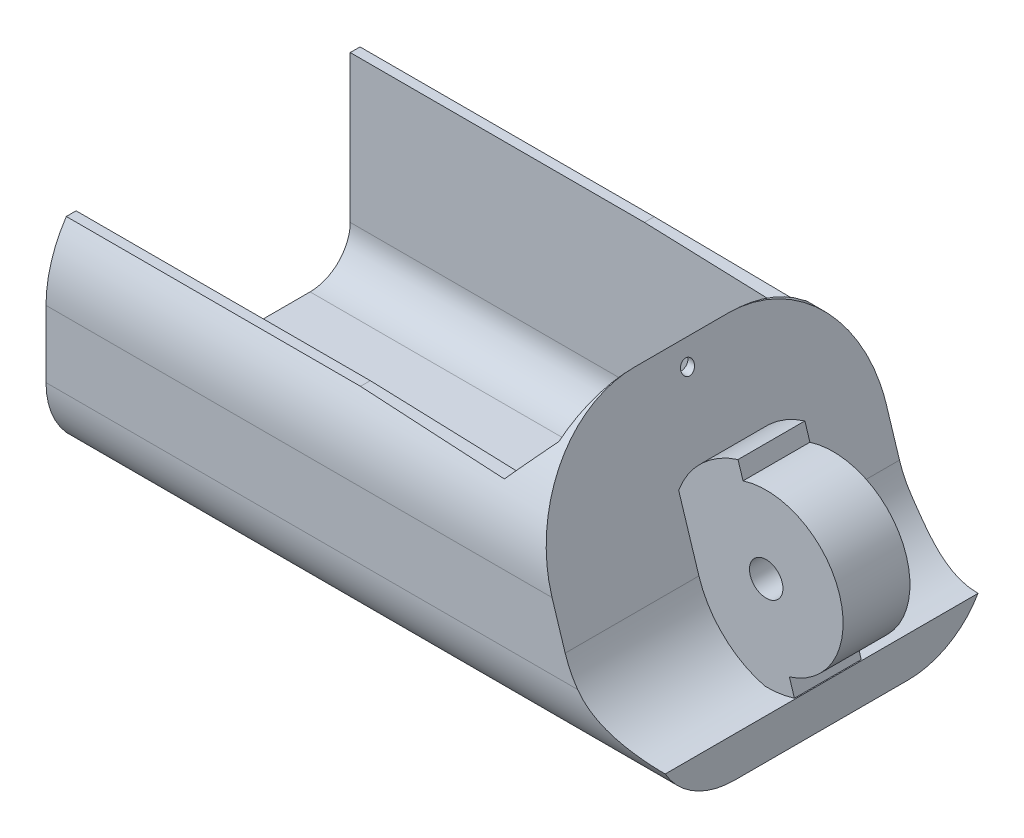
from build123d import *

# Parameters (mm, degrees)
CROQUIS1_W              = 105
CROQUIS1_H              = 40
SALIENTE_EXTRUIR1_DEPTH = 25
CORTAR_EXTRUIR1_DEPTH   = 50
CORTAR_EXTRUIR2_DEPTH   = 50
CROQUIS6_R              = 2.5
SALIENTE_EXTRUIR3_DEPTH = 5
CORTAR_EXTRUIR3_DEPTH   = 76.208044782
REDONDEO2_R             = 12
CORTAR_EXTRUIR4_DEPTH   = 110
CORTAR_EXTRUIR5_DEPTH   = 66
CROQUIS12_W             = 20
CROQUIS12_H             = 8
CROQUIS12_W_2           = 15.331196302
CROQUIS12_H_2           = 3
SALIENTE_EXTRUIR4_DEPTH = 2.5
CROQUIS13_R             = 1
CORTAR_EXTRUIR6_DEPTH   = 10
REDONDEO3_R             = 2
REDONDEO4_R             = 2
REDONDEO5_R             = 1


with BuildPart() as part:
    # Croquis1 → Saliente-Extruir1 (new, symmetric)
    with BuildSketch(Plane.XY):
        Rectangle(CROQUIS1_W, CROQUIS1_H)
    extrude(amount=SALIENTE_EXTRUIR1_DEPTH, both=True)

    # Croquis2 → Cortar-Extruir1 (cut)
    with BuildSketch(Plane.XY.offset(25)):
        Polygon((-52.5, 20), (-52.5, 12), (-46.5, 12), (-26.5, 12), (-8.5, 12), (13.5, 11.241881844), (17.5, 16), (17.5, 20), align=None)
    extrude(amount=-CORTAR_EXTRUIR1_DEPTH, mode=Mode.SUBTRACT)

    # Croquis5 → Cortar-Extruir2 (cut)
    with BuildSketch(Plane.XY.offset(25)):
        with BuildLine():
            Line((52.5, 20), (17.5, 20))
            Line((17.5, 20), (25.150275796, -4.217210414))
            ThreePointArc((25.150275796, -4.217210414), (40.633525386, -13.836476048), (52.5, 0))
            Line((52.5, 0), (52.5, 20))
        make_face()
    extrude(amount=-CORTAR_EXTRUIR2_DEPTH, mode=Mode.SUBTRACT)

    # Croquis6 → Saliente-Extruir3 (add, symmetric)
    with BuildSketch(Plane.XY):
        with BuildLine():
            Line((39.433873902, -12.915399918), (38.680800614, -10.531520596))
            ThreePointArc((38.680800614, -10.531520596), (46.18250837, 3.898461412), (31.752526362, 11.400169168))
            Line((31.752526362, 11.400169168), (30.999453074, 13.78404849))
            ThreePointArc((30.999453074, 13.78404849), (21.866939284, -3.782886128), (39.433873902, -12.915399918))
        make_face()
        with Locations((35.216663488, 0.434324286)):
            Circle(CROQUIS6_R, mode=Mode.SUBTRACT)
    extrude(amount=SALIENTE_EXTRUIR3_DEPTH, both=True)

    # Croquis8 → Cortar-Extruir3 (cut, through all)
    with BuildSketch(Plane.XY.offset(25)):
        with BuildLine():
            Line((38.5, -14), (38.5, -20))
            Line((38.5, -20), (52.5, -20))
            Line((52.5, -20), (52.5, 0))
            ThreePointArc((52.5, 0), (48.399494937, -9.899494937), (38.5, -14))
        make_face()
    extrude(amount=-CORTAR_EXTRUIR3_DEPTH, mode=Mode.SUBTRACT)

    # Redondeo2
    redondeo2_edges = [part.edges().sort_by_distance(p)[0] for p in [
        (-7, -20, -25),
        (-7, -20, 25),
    ]]
    fillet(redondeo2_edges, radius=REDONDEO2_R)

    # Croquis10 → Cortar-Extruir4 (cut)
    with BuildSketch(Plane.ZY.offset(52.5)):
        with BuildLine():
            Line((25, 32), (-25, 32))
            Line((-25, 32), (-25, 2))
            ThreePointArc((-25, 2), (-19.727922061, 14.727922061), (-7, 20))
            Line((-7, 20), (7, 20))
            ThreePointArc((7, 20), (19.727922061, 14.727922061), (25, 2))
            Line((25, 2), (25, 32))
        make_face()
    extrude(amount=-CORTAR_EXTRUIR4_DEPTH, mode=Mode.SUBTRACT)

    # Croquis11 → Cortar-Extruir5 (cut)
    with BuildSketch(Plane.ZY.offset(52.5)):
        with BuildLine():
            Line((20.5, 23.772379217), (-20.5, 23.772379217))
            Line((-20.5, 23.772379217), (-20.5, -10))
            ThreePointArc((-20.5, -10), (-18.742640687, -14.242640687), (-14.5, -16))
            Line((-14.5, -16), (14.5, -16))
            ThreePointArc((14.5, -16), (18.742640687, -14.242640687), (20.5, -10))
            Line((20.5, -10), (20.5, 23.772379217))
        make_face()
    extrude(amount=-CORTAR_EXTRUIR5_DEPTH, mode=Mode.SUBTRACT)

    # Croquis12 → Saliente-Extruir4 (add, symmetric)
    # profile 1 of 4: a face of its own
    with BuildSketch(Plane.XY):
        with Locations((-42.5, -24)):
            Rectangle(CROQUIS12_W, CROQUIS12_H)
        with Locations((-42.5, -24.5)):
            Rectangle(CROQUIS12_W_2, CROQUIS12_H_2, mode=Mode.SUBTRACT)
    # profile 2 of 4: a face of its own
    with BuildSketch(Plane.XY):
        Polygon((11.5, -20), (-8.5, -20), (-8.5, -24), (-8.5, -28), (11.5, -28), align=None)
        with Locations((1.5, -24.5)):
            Rectangle(CROQUIS12_W_2, CROQUIS12_H_2, mode=Mode.SUBTRACT)
    # profile 3 of 4: a face of its own
    with BuildSketch(Plane.XY):
        with BuildLine():
            Line((-32.5, -20), (-32.5, -24))
            add(Edge.make_bspline(
                [(-32.5, -24), (-26.5, -20), (-20.5, -20)],
                knots=[0, 0, 0, 0.5, 0.5, 0.5], degree=2))
            Line((-20.5, -20), (-32.5, -20))
        make_face()
    # profile 4 of 4: a face of its own
    with BuildSketch(Plane.XY):
        with BuildLine():
            Line((-8.5, -20), (-20.5, -20))
            add(Edge.make_bspline(
                [(-20.5, -20), (-14.5, -20), (-8.5, -24)],
                knots=[0.5, 0.5, 0.5, 1, 1, 1], degree=2))
            Line((-8.5, -24), (-8.5, -20))
        make_face()
    extrude(amount=SALIENTE_EXTRUIR4_DEPTH, both=True)

    # Croquis13 → Cortar-Extruir6 (cut)
    with BuildSketch(Plane.ZY.offset(-17.5)):
        with Locations((0, 17)):
            Circle(CROQUIS13_R)
    extrude(amount=-CORTAR_EXTRUIR6_DEPTH, mode=Mode.SUBTRACT)

    # Redondeo3
    redondeo3_edges = [part.edges().sort_by_distance(p)[0] for p in [
        (-8.5, -28, 0),
        (-52.5, -28, 0),
        (-32.5, -28, 0),
        (11.5, -28, 0),
    ]]
    fillet(redondeo3_edges, radius=REDONDEO3_R)

    # Redondeo4
    redondeo4_edges = [part.edges().sort_by_distance(p)[0] for p in [
        (11.5, -20, 0),
    ]]
    fillet(redondeo4_edges, radius=REDONDEO4_R)

    # Redondeo5
    redondeo5_edges = [part.edges().sort_by_distance(p)[0] for p in [
        (-34.834401849, -26, 0),
        (-50.165598151, -26, 0),
        (-50.165598151, -23, 0),
        (-34.834401849, -23, 0),
        (-6.165598151, -26, 0),
        (-6.165598151, -23, 0),
        (9.165598151, -26, 0),
        (9.165598151, -23, 0),
    ]]
    fillet(redondeo5_edges, radius=REDONDEO5_R)


solid = part.part
